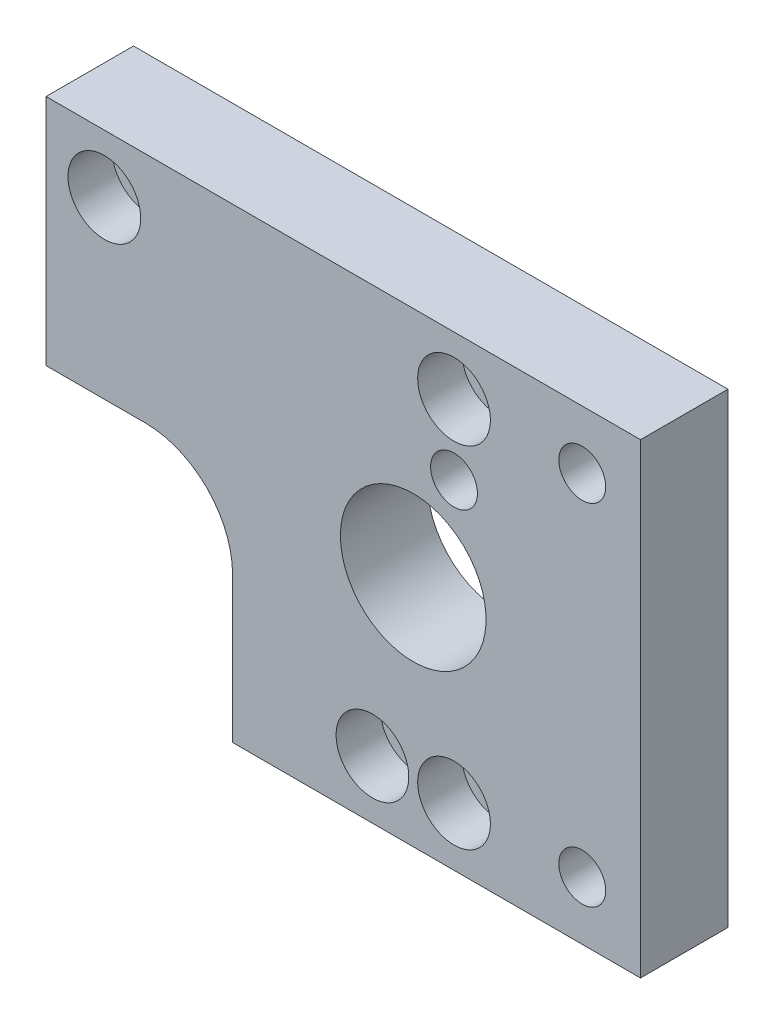
from build123d import *

# Parameters (mm, degrees)
SKETCH1_W                      = 64.77
SKETCH1_H                      = 50.8
SKETCH1_R                      = 2.5527
SKETCH1_R_2                    = 7.9375
BOSS_EXTRUDE1_DEPTH            = 9.525
F_7_0_201_DIAMETER_HOLE1_D     = 5.1054
F_7_0_201_DIAMETER_HOLE1_DEPTH = 70.104
F_7_0_201_DIAMETER_HOLE1_TIP   = 1.533816902
SKETCH6_R                      = 3.9624
CUT_EXTRUDE1_DEPTH             = 4.826
SKETCH7_W                      = 20.32
SKETCH7_H                      = 25.4
CUT_EXTRUDE2_DEPTH             = 48.81090383
FILLET2_R                      = 9.525


with BuildPart() as part:
    # Sketch1 → Boss-Extrude1 (new body)
    with BuildSketch(Plane.XY):
        with Locations((6.985, 0)):
            Rectangle(SKETCH1_W, SKETCH1_H)
        with Locations((-19.05, 19.05)):
            Circle(SKETCH1_R, mode=Mode.SUBTRACT)
        with Locations((19.05, 19.05)):
            Circle(SKETCH1_R, mode=Mode.SUBTRACT)
        with Locations((19.05, -19.05)):
            Circle(SKETCH1_R, mode=Mode.SUBTRACT)
        with Locations((10.16, -19.05)):
            Circle(SKETCH1_R, mode=Mode.SUBTRACT)
        with Locations((14.605, 0)):
            Circle(SKETCH1_R_2, mode=Mode.SUBTRACT)
    extrude(amount=BOSS_EXTRUDE1_DEPTH)

    # #7 (0.201) Diameter Hole1
    with Locations(Plane(origin=(-24.721209515, -12.864288698, 0), x_dir=(1, 0, 0), z_dir=(0, 0, -1))):
        with Locations((57.741209515, 6.185711302), (57.741209515, -31.914288698), (43.771209515, -24.294288698)):
            Hole(F_7_0_201_DIAMETER_HOLE1_D / 2, depth=F_7_0_201_DIAMETER_HOLE1_DEPTH)
            with Locations((0, 0, -(F_7_0_201_DIAMETER_HOLE1_DEPTH + F_7_0_201_DIAMETER_HOLE1_TIP / 2))):  # 118° drill point
                Cone(0, F_7_0_201_DIAMETER_HOLE1_D / 2, F_7_0_201_DIAMETER_HOLE1_TIP, mode=Mode.SUBTRACT)

    # Sketch6 → Cut-Extrude1 (cut)
    with BuildSketch(Plane(origin=(0, 0, 9.525), x_dir=(-1, 0, 0), z_dir=(0, 0, -1))):
        with Locations((-19.05, 19.05)):
            Circle(SKETCH6_R)
        with Locations((-19.05, -19.05)):
            Circle(SKETCH6_R)
        with Locations((-10.16, -19.05)):
            Circle(SKETCH6_R)
        with Locations((19.05, 19.05)):
            Circle(SKETCH6_R)
    extrude(amount=CUT_EXTRUDE1_DEPTH, mode=Mode.SUBTRACT)

    # Sketch7 → Cut-Extrude2 (cut, through all)
    with BuildSketch(Plane(origin=(0, 0, 0), x_dir=(-1, 0, 0), z_dir=(0, 0, -1))):
        with Locations((15.24, -12.7)):
            Rectangle(SKETCH7_W, SKETCH7_H)
    extrude(amount=-CUT_EXTRUDE2_DEPTH, mode=Mode.SUBTRACT)

    # Fillet2
    fillet2_edges = [part.edges().sort_by_distance(p)[0] for p in [
        (-5.08, 0, 4.7625),
    ]]
    fillet(fillet2_edges, radius=FILLET2_R)


solid = part.part
